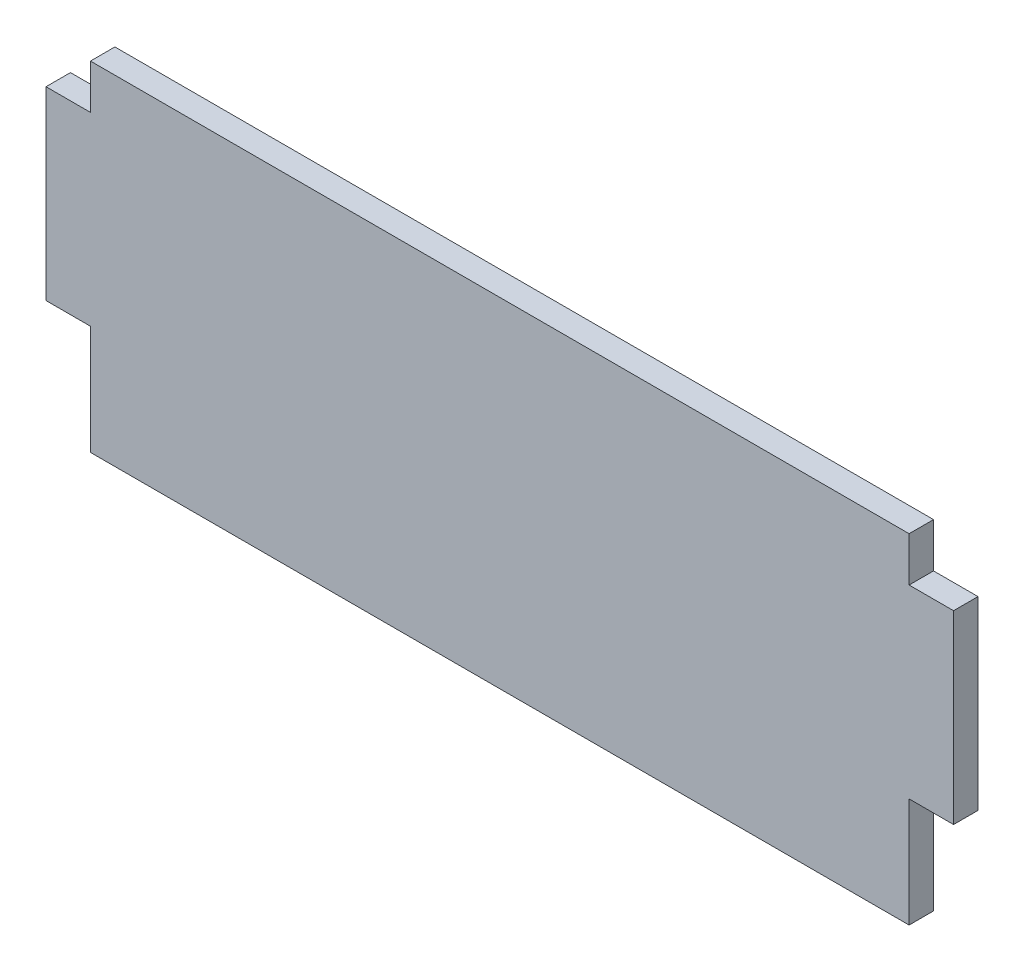
from build123d import *

# Parameters (mm, degrees)
BOSS_EXTRUDE1_DEPTH = 1.6764


with BuildPart() as part:
    # Sketch1 → Boss-Extrude1 (new body)
    with BuildSketch(Plane.XY):
        Polygon((3.048, 84.963), (0, 84.963), (0, 88.011), (-56.134, 88.011), (-56.134, 84.963), (-59.182, 84.963), (-59.182, 72.263), (-56.134, 72.263), (-56.134, 64.77), (0, 64.77), (0, 72.263), (3.048, 72.263), align=None)
    extrude(amount=BOSS_EXTRUDE1_DEPTH)


solid = part.part
